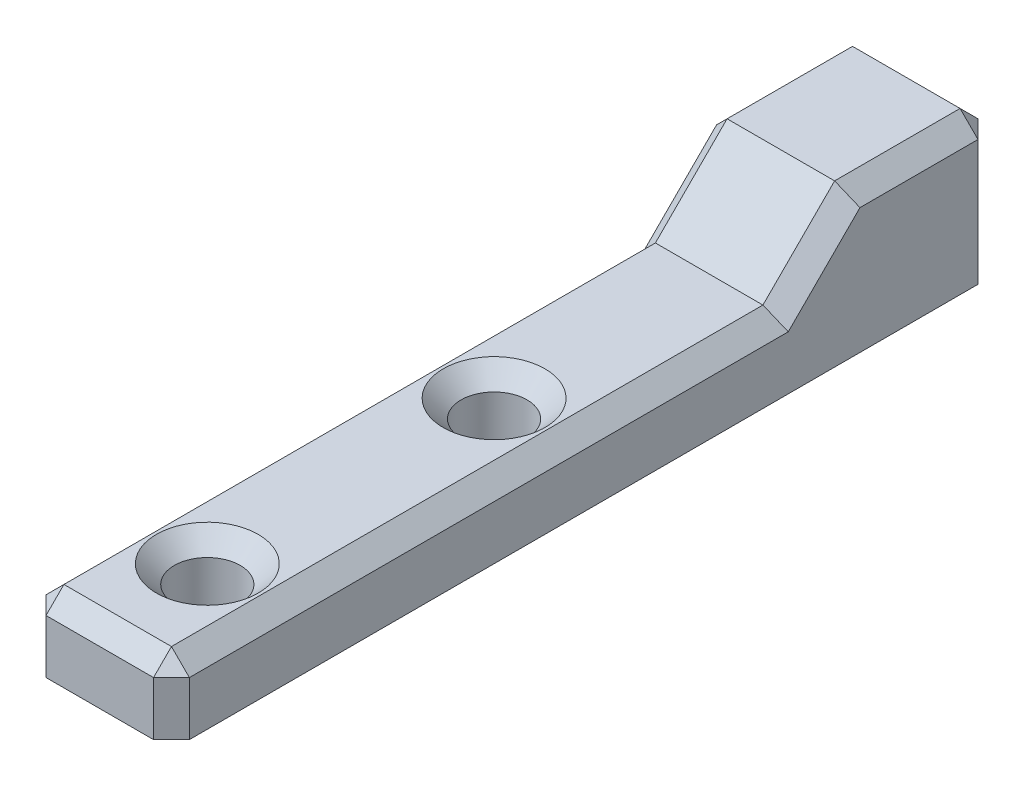
from build123d import *

# Parameters (mm, degrees)
SKETCH1_W           = 12.7
SKETCH1_H           = 73.025
SKETCH1_R           = 2.921
BOSS_EXTRUDE1_DEPTH = 12.7
SKETCH2_W           = 60.325
SKETCH2_H           = 6.35
CUT_EXTRUDE1_DEPTH  = 76.201267443
CHAMFER1_SIZE       = 6.35


# Some blends are built 0.0001 mm under size
with BuildPart() as part:
    # Sketch1 → Boss-Extrude1 (new body)
    with BuildSketch(Plane(origin=(0, 0, 0), x_dir=(1, 0, 0), z_dir=(0, 1, 0))):
        with Locations((6.35, 36.5125)):
            Rectangle(SKETCH1_W, SKETCH1_H)
        with Locations(Location((6.35, 9.525, 0), (0, 0, 270))):
            Circle(SKETCH1_R, mode=Mode.SUBTRACT)
        with Locations(Location((6.35, 34.925, 0), (0, 0, 270))):
            Circle(SKETCH1_R, mode=Mode.SUBTRACT)
    extrude(amount=BOSS_EXTRUDE1_DEPTH)

    # Sketch2 → Cut-Extrude1 (cut, through all)
    with BuildSketch(Plane(origin=(12.7, 0, 0), x_dir=(0, 0, -1), z_dir=(1, 0, 0))):
        with Locations((30.1625, 9.525)):
            Rectangle(SKETCH2_W, SKETCH2_H)
    extrude(amount=-CUT_EXTRUDE1_DEPTH, mode=Mode.SUBTRACT)

    # Chamfer1
    chamfer1_edges = [part.edges().sort_by_distance(p)[0] for p in [
        (6.35, 6.35, -60.325),
    ]]
    chamfer(chamfer1_edges, length=CHAMFER1_SIZE - 0.0001)  # a hair under: the kernel refuses the full size

    # Chamfer2
    # the kernel refuses this chamfer: 1.5875 mm, written as the material it takes off along each edge
    with BuildSketch(Plane(origin=(11.641666667, 11.641666667, -71.966666667), x_dir=(-0.7071067811865476, 0.7071067811865476, 0), z_dir=(0.5773502691896264, 0.5773502691896264, -0.5773502691896245)), Plane(origin=(1.058333333, 5.291666667, -1.058333333), x_dir=(0.7071067811865476, 0.7071067811865476, 3.1649107828586326e-15), z_dir=(-0.5773502691896274, 0.5773502691896248, 0.5773502691896252))) as chamfer2_piece_1:
        Polygon((-1.122532015, 0.648094161), (1.122532015, 0.648094161), (0, -1.296188322), align=None)
    extrude(amount=2.016395815, mode=Mode.SUBTRACT)
    with BuildSketch(Plane(origin=(1.058333333, 11.641666667, -71.966666667), x_dir=(0.7071067811865476, 0.7071067811865476, 0), z_dir=(-0.5773502691896264, 0.5773502691896264, -0.5773502691896245)), Plane(origin=(11.641666667, 5.291666667, -1.058333333), x_dir=(-0.7071067811865476, 0.7071067811865476, 0), z_dir=(0.577350269189626, 0.5773502691896254, 0.5773502691896262))) as chamfer2_piece_2:
        Polygon((-1.122532015, -0.648094161), (1.122532015, -0.648094161), (0, 1.296188322), align=None)
    extrude(amount=2.016395815, mode=Mode.SUBTRACT)
    with BuildSketch(Plane(origin=(16.782546743, 12.7, -73.025), x_dir=(0, 0.027495876610586667, 0.9996219169112968), z_dir=(-1, 0, 0)), Plane(origin=(0, 12.7, -77.107546743), x_dir=(0.9996219169112968, 0.02749587661058674, 0), z_dir=(0, 0, 1)), Plane(origin=(0, -4.082546743, -73.025), x_dir=(0.9996219169112968, 0, -0.02749587661058565), z_dir=(0, 1, 0)), Plane(origin=(12.7, -4.082546743, -73.025), x_dir=(0.027495876610586667, 0, 0.9996219169112968), z_dir=(0, 1, 0))) as chamfer2_piece_3:
        with BuildLine():
            Line((1.633018697, 0), (-0.089768608, -1.630549497))
            Line((-0.089768608, -1.630549497), (-0.121506604, -1.629676503))
            ThreePointArc((-0.121506604, -1.629676503), (-0.054180148, -0.815019055), (-0.031737996, 0.000872994))
            Line((-0.031737996, 0.000872994), (0.000872994, 0.031737996))
            ThreePointArc((0.000872994, 0.031737996), (0.816765043, 0.009295844), (1.633891691, 0.031737996))
            Line((1.633891691, 0.031737996), (1.633018697, 0))
        make_face()
    extrude(amount=20.865093487, mode=Mode.SUBTRACT)
    with BuildSketch(Plane(origin=(12.7, 12.7, -56.242453257), x_dir=(0.027495876610586726, -0.9996219169112968, 0), z_dir=(0, 0, -1)), Plane(origin=(16.782546743, 6.35, 0), x_dir=(0, 0.027495876610586223, -0.9996219169112968), z_dir=(-1, 0, 0))) as chamfer2_piece_4:
        with BuildLine():
            Line((1.633018697, 0), (-0.089768608, 1.630549497))
            Line((-0.089768608, 1.630549497), (-0.121506604, 1.629676503))
            ThreePointArc((-0.121506604, 1.629676503), (-0.054180148, 0.815019055), (-0.031737996, -0.000872994))
            Line((-0.031737996, -0.000872994), (0.000872994, -0.031737996))
            ThreePointArc((0.000872994, -0.031737996), (0.816765043, -0.009295844), (1.633891691, -0.031737996))
            Line((1.633891691, -0.031737996), (1.633018697, 0))
        make_face()
    extrude(amount=20.865093487, mode=Mode.SUBTRACT)
    with BuildSketch(Plane(origin=(12.7, -4.082546743, 0), x_dir=(0.027495876610586743, 0, -0.9996219169112966), z_dir=(0, 1, 0)), Plane(origin=(0, -4.082546743, 0), x_dir=(0.9996219169112966, 0, 0.027495876610586424), z_dir=(0, 1, 0))) as chamfer2_piece_5:
        with BuildLine():
            Line((1.633018697, 0), (-0.089768608, 1.630549497))
            Line((-0.089768608, 1.630549497), (-0.121506604, 1.629676503))
            ThreePointArc((-0.121506604, 1.629676503), (-0.054180148, 0.815019055), (-0.031737996, -0.000872994))
            Line((-0.031737996, -0.000872994), (0.000872994, -0.031737996))
            ThreePointArc((0.000872994, -0.031737996), (0.816765043, -0.009295844), (1.633891691, -0.031737996))
            Line((1.633891691, -0.031737996), (1.633018697, 0))
        make_face()
    extrude(amount=14.515093487, mode=Mode.SUBTRACT)
    with BuildSketch(Plane(origin=(6.35, 6.35, -9.525), x_dir=(0, 0, 1), z_dir=(1, 0, 0))) as chamfer2_piece_6:
        with BuildLine():
            Line((4.553401281, -0.044901281), (2.876098719, 1.632401281))
            Line((2.876098719, 1.632401281), (2.844348719, 1.632401281))
            ThreePointArc((2.844348719, 1.632401281), (2.88925, 0.81620064), (2.88925, 0))
            Line((2.88925, 0), (2.921, -0.03175))
            ThreePointArc((2.921, -0.03175), (3.73720064, -0.03175), (4.553401281, -0.076651281))
            Line((4.553401281, -0.076651281), (4.553401281, -0.044901281))
        make_face()
    revolve(axis=Axis((6.35, 6.35, -9.525), (0, -1, 0)), mode=Mode.SUBTRACT)
    with BuildSketch(Plane(origin=(6.35, 6.35, -34.925), x_dir=(0, 0, 1), z_dir=(1, 0, 0))) as chamfer2_piece_7:
        with BuildLine():
            Line((4.553401281, -0.044901281), (2.876098719, 1.632401281))
            Line((2.876098719, 1.632401281), (2.844348719, 1.632401281))
            ThreePointArc((2.844348719, 1.632401281), (2.88925, 0.81620064), (2.88925, 0))
            Line((2.88925, 0), (2.921, -0.03175))
            ThreePointArc((2.921, -0.03175), (3.73720064, -0.03175), (4.553401281, -0.076651281))
            Line((4.553401281, -0.076651281), (4.553401281, -0.044901281))
        make_face()
    revolve(axis=Axis((6.35, 6.35, -34.925), (0, -1, 0)), mode=Mode.SUBTRACT)
    with BuildSketch(Plane(origin=(0, 6.35, -58.057646743), x_dir=(0.9996219169112968, 0.027495876610586195, 0), z_dir=(0, 0, 1))) as chamfer2_piece_8_section:
        with BuildLine():
            Line((1.633018697, 0), (-0.089768608, -1.630549497))
            Line((-0.089768608, -1.630549497), (-0.121506604, -1.629676503))
            ThreePointArc((-0.121506604, -1.629676503), (-0.054180148, -0.815019055), (-0.031737996, 0.000872994))
            Line((-0.031737996, 0.000872994), (0.000872994, 0.031737996))
            ThreePointArc((0.000872994, 0.031737996), (0.816765043, 0.009295844), (1.633891691, 0.031737996))
            Line((1.633891691, 0.031737996), (1.633018697, 0))
        make_face()
    chamfer2_piece_8 = extrude(amount=62.140193487, mode=Mode.PRIVATE)
    chamfer2_piece_8 = split(chamfer2_piece_8, bisect_by=Plane(origin=(0.525034433, -8.55498603, -39.07011397), z_dir=(0, 0.7071067811865474, 0.7071067811865477)), keep=Keep.TOP, mode=Mode.PRIVATE)
    add(chamfer2_piece_8, mode=Mode.SUBTRACT)
    with BuildSketch(Plane(origin=(12.7, 6.35, -58.057646743), x_dir=(0.02749587661058674, -0.9996219169112966, 0), z_dir=(0, 0, 1))) as chamfer2_piece_9_section:
        with BuildLine():
            Line((1.633018697, 0), (-0.089768608, -1.630549497))
            Line((-0.089768608, -1.630549497), (-0.121506604, -1.629676503))
            ThreePointArc((-0.121506604, -1.629676503), (-0.054180148, -0.815019055), (-0.031737996, 0.000872994))
            Line((-0.031737996, 0.000872994), (0.000872994, 0.031737996))
            ThreePointArc((0.000872994, 0.031737996), (0.816765043, 0.009295844), (1.633891691, 0.031737996))
            Line((1.633891691, 0.031737996), (1.633018697, 0))
        make_face()
    chamfer2_piece_9 = extrude(amount=62.140193487, mode=Mode.PRIVATE)
    chamfer2_piece_9 = split(chamfer2_piece_9, bisect_by=Plane(origin=(12.174965567, -8.55498603, -39.07011397), z_dir=(0, 0.7071067811865474, 0.7071067811865477)), keep=Keep.TOP, mode=Mode.PRIVATE)
    add(chamfer2_piece_9, mode=Mode.SUBTRACT)
    with BuildSketch(Plane(origin=(12.7, 3.463203513, -51.088303513), x_dir=(0.02749587661058673, -0.7068394360706733, -0.7068394360706736), z_dir=(0, 0.7071067811865477, -0.7071067811865474))) as chamfer2_piece_10_section:
        with BuildLine():
            Line((1.633018697, 0), (-0.089768608, 1.630549497))
            Line((-0.089768608, 1.630549497), (-0.121506604, 1.629676503))
            ThreePointArc((-0.121506604, 1.629676503), (-0.054180148, 0.815019055), (-0.031737996, -0.000872994))
            Line((-0.031737996, -0.000872994), (0.000872994, -0.031737996))
            ThreePointArc((0.000872994, -0.031737996), (0.816765043, -0.009295844), (1.633891691, -0.031737996))
            Line((1.633891691, -0.031737996), (1.633018697, 0))
        make_face()
    chamfer2_piece_10 = extrude(amount=17.145208187, mode=Mode.PRIVATE)
    chamfer2_piece_10 = split(chamfer2_piece_10, bisect_by=Plane(origin=(12.154882998, 6.35, -57.491724347), z_dir=(0, 1, 0)), keep=Keep.TOP, mode=Mode.PRIVATE)
    add(chamfer2_piece_10, mode=Mode.SUBTRACT)
    with BuildSketch(Plane(origin=(0, 3.463203513, -51.088303513), x_dir=(0.9996219169112968, 0.019442520806015003, 0.019442520806015013), z_dir=(0, 0.7071067811865477, -0.7071067811865474))) as chamfer2_piece_11_section:
        with BuildLine():
            Line((1.633018697, 0), (-0.089768608, 1.630549497))
            Line((-0.089768608, 1.630549497), (-0.121506604, 1.629676503))
            ThreePointArc((-0.121506604, 1.629676503), (-0.054180148, 0.815019055), (-0.031737996, -0.000872994))
            Line((-0.031737996, -0.000872994), (0.000872994, -0.031737996))
            ThreePointArc((0.000872994, -0.031737996), (0.816765043, -0.009295844), (1.633891691, -0.031737996))
            Line((1.633891691, -0.031737996), (1.633018697, 0))
        make_face()
    chamfer2_piece_11 = extrude(amount=17.145208187, mode=Mode.PRIVATE)
    chamfer2_piece_11 = split(chamfer2_piece_11, bisect_by=Plane(origin=(0.545117002, 6.35, -57.491724347), z_dir=(0, 1, 0)), keep=Keep.TOP, mode=Mode.PRIVATE)
    add(chamfer2_piece_11, mode=Mode.SUBTRACT)
    with BuildSketch(Plane(origin=(0, 3.463203513, -51.088303513), x_dir=(0.9996219169112968, 0.019442520806015003, 0.019442520806015013), z_dir=(0, 0.7071067811865477, -0.7071067811865474))) as chamfer2_piece_12a_section:
        with BuildLine():
            Line((1.633018697, 0), (-0.089768608, 1.630549497))
            Line((-0.089768608, 1.630549497), (-0.121506604, 1.629676503))
            ThreePointArc((-0.121506604, 1.629676503), (-0.054180148, 0.815019055), (-0.031737996, -0.000872994))
            Line((-0.031737996, -0.000872994), (0.000872994, -0.031737996))
            ThreePointArc((0.000872994, -0.031737996), (0.816765043, -0.009295844), (1.633891691, -0.031737996))
            Line((1.633891691, -0.031737996), (1.633018697, 0))
        make_face()
    chamfer2_piece_12a = extrude(amount=17.145208187, mode=Mode.PRIVATE)
    chamfer2_piece_12a = split(chamfer2_piece_12a, bisect_by=Plane(origin=(0.504972836, 6.35, -53.123859696), z_dir=(0, -1, 0)), keep=Keep.TOP, mode=Mode.PRIVATE)
    with BuildSketch(Plane(origin=(0, 6.35, -58.057646743), x_dir=(0.9996219169112968, 0.027495876610586195, 0), z_dir=(0, 0, 1))) as chamfer2_piece_12b_section:
        with BuildLine():
            Line((1.633018697, 0), (-0.089768608, -1.630549497))
            Line((-0.089768608, -1.630549497), (-0.121506604, -1.629676503))
            ThreePointArc((-0.121506604, -1.629676503), (-0.054180148, -0.815019055), (-0.031737996, 0.000872994))
            Line((-0.031737996, 0.000872994), (0.000872994, 0.031737996))
            ThreePointArc((0.000872994, 0.031737996), (0.816765043, 0.009295844), (1.633891691, 0.031737996))
            Line((1.633891691, 0.031737996), (1.633018697, 0))
        make_face()
    chamfer2_piece_12b = extrude(amount=62.140193487, mode=Mode.PRIVATE)
    chamfer2_piece_12b = split(chamfer2_piece_12b, bisect_by=Plane(origin=(0.504972836, 6.951917791, -54.577017791), z_dir=(0, -0.7071067811865474, -0.7071067811865477)), keep=Keep.TOP, mode=Mode.PRIVATE)
    chamfer2_piece_12 = chamfer2_piece_12a & chamfer2_piece_12b
    add(chamfer2_piece_12, mode=Mode.SUBTRACT)
    with BuildSketch(Plane(origin=(12.7, 3.463203513, -51.088303513), x_dir=(0.02749587661058673, -0.7068394360706733, -0.7068394360706736), z_dir=(0, 0.7071067811865477, -0.7071067811865474))) as chamfer2_piece_13a_section:
        with BuildLine():
            Line((1.633018697, 0), (-0.089768608, 1.630549497))
            Line((-0.089768608, 1.630549497), (-0.121506604, 1.629676503))
            ThreePointArc((-0.121506604, 1.629676503), (-0.054180148, 0.815019055), (-0.031737996, -0.000872994))
            Line((-0.031737996, -0.000872994), (0.000872994, -0.031737996))
            ThreePointArc((0.000872994, -0.031737996), (0.816765043, -0.009295844), (1.633891691, -0.031737996))
            Line((1.633891691, -0.031737996), (1.633018697, 0))
        make_face()
    chamfer2_piece_13a = extrude(amount=17.145208187, mode=Mode.PRIVATE)
    chamfer2_piece_13a = split(chamfer2_piece_13a, bisect_by=Plane(origin=(12.195027164, 6.35, -53.123859696), z_dir=(0, -1, 0)), keep=Keep.TOP, mode=Mode.PRIVATE)
    with BuildSketch(Plane(origin=(12.7, 6.35, -58.057646743), x_dir=(0.02749587661058674, -0.9996219169112966, 0), z_dir=(0, 0, 1))) as chamfer2_piece_13b_section:
        with BuildLine():
            Line((1.633018697, 0), (-0.089768608, -1.630549497))
            Line((-0.089768608, -1.630549497), (-0.121506604, -1.629676503))
            ThreePointArc((-0.121506604, -1.629676503), (-0.054180148, -0.815019055), (-0.031737996, 0.000872994))
            Line((-0.031737996, 0.000872994), (0.000872994, 0.031737996))
            ThreePointArc((0.000872994, 0.031737996), (0.816765043, 0.009295844), (1.633891691, 0.031737996))
            Line((1.633891691, 0.031737996), (1.633018697, 0))
        make_face()
    chamfer2_piece_13b = extrude(amount=62.140193487, mode=Mode.PRIVATE)
    chamfer2_piece_13b = split(chamfer2_piece_13b, bisect_by=Plane(origin=(12.195027164, 6.951917791, -54.577017791), z_dir=(0, -0.7071067811865474, -0.7071067811865477)), keep=Keep.TOP, mode=Mode.PRIVATE)
    chamfer2_piece_13 = chamfer2_piece_13a & chamfer2_piece_13b
    add(chamfer2_piece_13, mode=Mode.SUBTRACT)


solid = part.part
